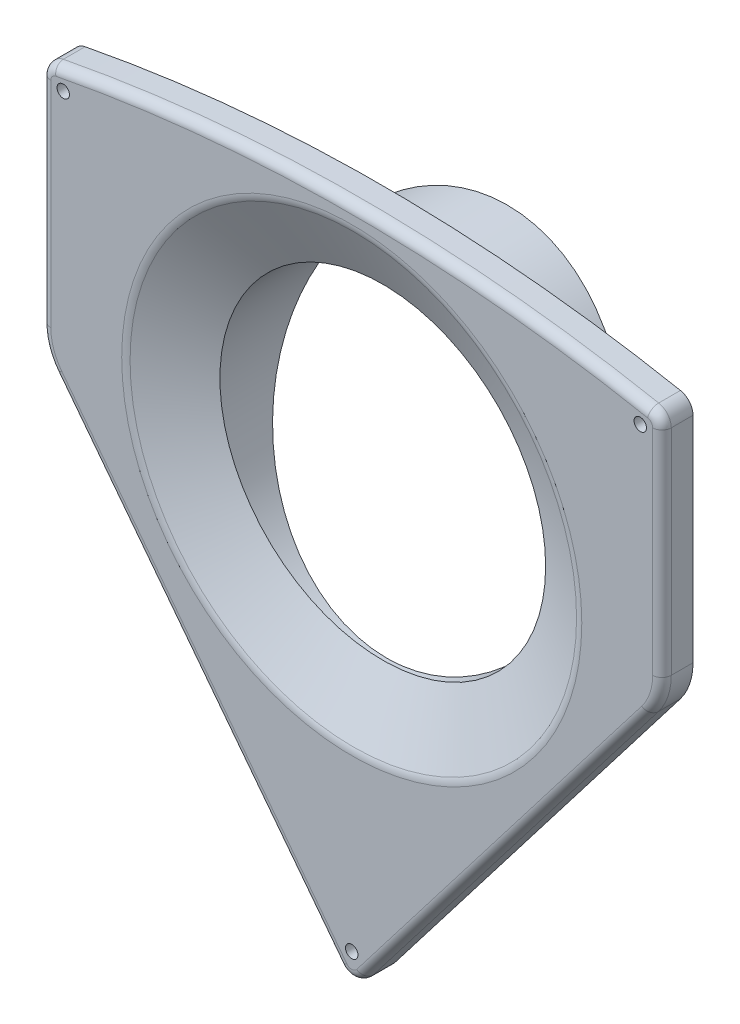
from build123d import *

# Parameters (mm, degrees)
BOSS_EXTRUDE1_DEPTH = 10
SKETCH3_R           = 73
SKETCH2_R           = 52.5
FILLET3_R           = 5
FILLET4_R           = 20
SHELL4_T            = -2
BOSS_EXTRUDE3_START = 8
BOSS_EXTRUDE3_DEPTH = 8
SKETCH16_R          = 2
CUT_EXTRUDE8_DEPTH  = 9
SKETCH5_R           = 54.5
SKETCH5_R_2         = 52.5
BOSS_EXTRUDE2_DEPTH = 60
SKETCH9_R           = 112.367107934
CUT_EXTRUDE5_DEPTH  = 60
SKETCH10_R          = 91.913425111
CUT_EXTRUDE6_DEPTH  = 10
SKETCH11_R          = 79.181330982
CUT_EXTRUDE7_DEPTH  = 10
FILLET5_R           = 5
FILLET6_R           = 5
FILLET7_R           = 3
FILLET8_R           = 5
FILLET9_R           = 2
FILLET10_R          = 5


with BuildPart() as part:
    # Sketch1 → Boss-Extrude1 (new body)
    with BuildSketch(Plane.XY):
        with BuildLine():
            Line((100, 99.277863028), (100, 19.277863028))
            Line((100, 19.277863028), (0, -110.722136972))
            Line((0, -110.722136972), (-100, 19.277863028))
            Line((-100, 19.277863028), (-100, 99.277863028))
            ThreePointArc((-100, 99.277863028), (0, 109.277863028), (100, 99.277863028))
        make_face()
    extrude(amount=BOSS_EXTRUDE1_DEPTH)

    # Sketch3 → Cut-Loft1 section 0
    with BuildSketch(Plane.XY.offset(10)):
        with Locations((0, 29.277863028)):
            Circle(SKETCH3_R)
    # Sketch2 → Cut-Loft1 section 1
    with BuildSketch(Plane.XY):
        with Locations((0, 29.277863028)):
            Circle(SKETCH2_R)
    loft(mode=Mode.SUBTRACT)

    # Fillet3
    fillet3_edges = [part.edges().sort_by_distance(p)[0] for p in [
        (0, -110.722136972, 5),
    ]]
    fillet(fillet3_edges, radius=FILLET3_R)

    # Fillet4
    fillet4_edges = [part.edges().sort_by_distance(p)[0] for p in [
        (100, 19.277863028, 5),
        (-100, 19.277863028, 5),
    ]]
    fillet(fillet4_edges, radius=FILLET4_R)

    # Shell4
    shell4_openings = [part.faces().sort_by_distance(p)[0] for p in [
        (47.569868433, -44.043588356, 0),
    ]]
    offset(amount=SHELL4_T, openings=shell4_openings, kind=Kind.INTERSECTION)

    # Sketch12 → Boss-Extrude3 (add)
    with BuildSketch(Plane(origin=(0, 0, 8), x_dir=(-1, 0, 0), z_dir=(0, 0, -1)).offset(BOSS_EXTRUDE3_START)):
        with BuildLine():
            Line((-9.169512185, -95.521527238), (9.169512185, -95.521527238))
            Line((9.169512185, -95.521527238), (2.377871967, -104.350659521))
            ThreePointArc((2.377871967, -104.350659521), (0, -105.521527238), (-2.377871967, -104.350659521))
            Line((-2.377871967, -104.350659521), (-9.169512185, -95.521527238))
        make_face()
        with BuildLine():
            Line((98, 87.63878568), (98, 97.63878568))
            ThreePointArc((98, 97.63878568), (93.090974034, 98.588565475), (88.172749454, 99.48950087))
            ThreePointArc((88.172749454, 99.48950087), (90.302365562, 91.255493109), (98, 87.63878568))
        make_face()
        with BuildLine():
            Line((-98, 97.63878568), (-98, 87.63878568))
            ThreePointArc((-98, 87.63878568), (-90.302365562, 91.255493109), (-88.172749454, 99.48950087))
            ThreePointArc((-88.172749454, 99.48950087), (-93.090974034, 98.588565475), (-98, 97.63878568))
        make_face()
    extrude(amount=-BOSS_EXTRUDE3_DEPTH)

    # Sketch16 → Cut-Extrude8 (cut, symmetric)
    with BuildSketch(Plane(origin=(0, 0, 8), x_dir=(-1, 0, 0), z_dir=(0, 0, -1))):
        with Locations((0, -99.521527238)):
            Circle(SKETCH16_R)
        with Locations((-93, 94.13878568)):
            Circle(SKETCH16_R)
        with Locations((93, 94.13878568)):
            Circle(SKETCH16_R)
    extrude(amount=CUT_EXTRUDE8_DEPTH, both=True, mode=Mode.SUBTRACT)

    # Sketch5 → Boss-Extrude2 (add)
    with BuildSketch(Plane(origin=(0, 0, 0), x_dir=(-1, 0, 0), z_dir=(0, 0, -1))):
        with Locations(Location((0, 29.277863028, 0), (0, 0, 180))):
            Circle(SKETCH5_R)
        with Locations(Location((0, 29.277863028, 0), (0, 0, 180))):
            Circle(SKETCH5_R_2, mode=Mode.SUBTRACT)
    extrude(amount=BOSS_EXTRUDE2_DEPTH)

    # Sketch9 → Cut-Extrude5 (cut)
    with BuildSketch(Plane(origin=(0, -4.696341029, -10.071335838), x_dir=(-1, 0, 0), z_dir=(0, -0.42261826174070327, -0.9063077870366482))):
        with Locations((0, 89.719397921)):
            Circle(SKETCH9_R)
    extrude(amount=CUT_EXTRUDE5_DEPTH, mode=Mode.SUBTRACT)

    # Sketch10 → Cut-Extrude6 (cut)
    with BuildSketch(Plane(origin=(0, -4.030519152, -9.495308079), x_dir=(-1, 0, 0), z_dir=(0, -0.39073112848928093, -0.9205048534524374))):
        with Locations((0, 68.891691178)):
            Circle(SKETCH10_R)
    extrude(amount=CUT_EXTRUDE6_DEPTH, mode=Mode.SUBTRACT)

    # Sketch11 → Cut-Extrude7 (cut)
    with BuildSketch(Plane(origin=(0, -3.111126453, -8.547749678), x_dir=(-1, 0, 0), z_dir=(0, -0.34202014332567576, -0.9396926207859059))):
        with Locations((0, 55.651285061)):
            Circle(SKETCH11_R)
    extrude(amount=CUT_EXTRUDE7_DEPTH, mode=Mode.SUBTRACT)

    # Fillet5
    fillet5_edges = [part.edges().sort_by_distance(p)[0] for p in [
        (100, 99.277863028, 5),
    ]]
    fillet(fillet5_edges, radius=FILLET5_R)

    # Fillet6
    fillet6_edges = [part.edges().sort_by_distance(p)[0] for p in [
        (-100, 99.277863028, 5),
    ]]
    fillet(fillet6_edges, radius=FILLET6_R)

    # Fillet7
    fillet7_edges = [part.edges().sort_by_distance(p)[0] for p in [
        (0, 109.277863028, 10),
        (98.856812155, 98.351888702, 10),
        (-100, 60.625105075, 10),
        (-98.856812155, 98.351888702, 10),
        (49.907799864, -45.841997149, 10),
        (0, -107.521527238, 10),
        (100, 60.625105075, 10),
        (-49.907799864, -45.841997149, 10),
        (-98.934751063, 19.640177571, 10),
        (98.934751063, 19.640177571, 10),
    ]]
    fillet(fillet7_edges, radius=FILLET7_R)

    # Fillet8
    fillet8_edges = [part.edges().sort_by_distance(p)[0] for p in [
        (-73, 29.277863028, 10),
    ]]
    fillet(fillet8_edges, radius=FILLET8_R)

    # Fillet9
    fillet9_edges = [part.edges().sort_by_distance(p)[0] for p in [
        (-54.5, 29.277863028, 0),
    ]]
    fillet(fillet9_edges, radius=FILLET9_R)

    # Fillet10
    # the kernel refuses this fillet: 5 mm, written as the material it adds along each edge
    with BuildSketch(Plane(origin=(-80, 26.080301962, 8), x_dir=(-1, 0, 0), z_dir=(0, 1, 0))) as fillet10_piece_1:
        with BuildLine():
            CenterArc((18 - FILLET10_R, -FILLET10_R), FILLET10_R, 0, 90)
            Line((18, -FILLET10_R), (18 + FILLET10_R * 0.02, -FILLET10_R))
            Line((18 + FILLET10_R * 0.02, -FILLET10_R), (18 + FILLET10_R * 0.02, FILLET10_R * 0.02))
            Line((18 + FILLET10_R * 0.02, FILLET10_R * 0.02), (18 - FILLET10_R, FILLET10_R * 0.02))
            Line((18 - FILLET10_R, FILLET10_R * 0.02), (18 - FILLET10_R, 0))
        make_face()
    revolve(axis=Axis((-80, 26.080301962, 8), (0, 0, 1)), revolution_arc=37.568592029)
    with BuildSketch(Plane(origin=(-1.548127674, -105.429327102, 8), x_dir=(0.7926239891046, 0.6097107608496924, 0), z_dir=(-0.6097107608496926, 0.7926239891046001, 0))) as fillet10_piece_2_section:
        with BuildLine():
            CenterArc((FILLET10_R, FILLET10_R), FILLET10_R, 180, 90)
            Line((0, FILLET10_R), (-FILLET10_R * 0.02, FILLET10_R))
            Line((-FILLET10_R * 0.02, FILLET10_R), (-FILLET10_R * 0.02, -FILLET10_R * 0.02))
            Line((-FILLET10_R * 0.02, -FILLET10_R * 0.02), (FILLET10_R, -FILLET10_R * 0.02))
            Line((FILLET10_R, -FILLET10_R * 0.02), (FILLET10_R, 0))
        make_face()
    fillet10_piece_2 = extrude(amount=152.07063756, mode=Mode.PRIVATE)
    fillet10_piece_2 = split(fillet10_piece_2, bisect_by=Plane(origin=(-50.54915131, -95.521527238, 6.871784101), z_dir=(0, 1, 0)), keep=Keep.TOP, mode=Mode.PRIVATE)
    add(fillet10_piece_2)
    with BuildSketch(Plane(origin=(-98, 26.080301962, 8), x_dir=(1, 0, 0), z_dir=(0, 1, 0))) as fillet10_piece_3_section:
        with BuildLine():
            CenterArc((FILLET10_R, FILLET10_R), FILLET10_R, 180, 90)
            Line((0, FILLET10_R), (-FILLET10_R * 0.02, FILLET10_R))
            Line((-FILLET10_R * 0.02, FILLET10_R), (-FILLET10_R * 0.02, -FILLET10_R * 0.02))
            Line((-FILLET10_R * 0.02, -FILLET10_R * 0.02), (FILLET10_R, -FILLET10_R * 0.02))
            Line((FILLET10_R, -FILLET10_R * 0.02), (FILLET10_R, 0))
        make_face()
    fillet10_piece_3 = extrude(amount=74.058483718, mode=Mode.PRIVATE)
    fillet10_piece_3 = fillet10_piece_3 - Plane(origin=(-98, 97.63878568, 6.86971186), x_dir=(0.9827250545662549, 0.18507151895348808, 0), z_dir=(0, 0, -1)) * Cylinder(10, 169, mode=Mode.PRIVATE)
    add(fillet10_piece_3)
    with BuildSketch(Plane(origin=(0, -395.722136972, 8), x_dir=(-0.19970369332898327, 0.9798563337912163, 0), z_dir=(-0.9798563337912163, -0.19970369332898327, 0))) as fillet10_piece_4_section:
        with BuildLine():
            CenterArc((503 - FILLET10_R, FILLET10_R), FILLET10_R, 270, 90)
            Line((503, FILLET10_R), (503 + FILLET10_R * 0.02, FILLET10_R))
            Line((503 + FILLET10_R * 0.02, FILLET10_R), (503 + FILLET10_R * 0.02, -FILLET10_R * 0.02))
            Line((503 + FILLET10_R * 0.02, -FILLET10_R * 0.02), (503 - FILLET10_R, -FILLET10_R * 0.02))
            Line((503 - FILLET10_R, -FILLET10_R * 0.02), (503 - FILLET10_R, 0))
        make_face()
    fillet10_piece_4 = revolve(axis=Axis((0, -395.722136972, 8), (0, 0, -1)), revolution_arc=23.03926473, mode=Mode.PRIVATE)
    fillet10_piece_4 = fillet10_piece_4 - Plane(origin=(-98, 97.63878568, 6.609161961), x_dir=(0.9827250545662549, 0.18507151895348808, 0), z_dir=(0, 0, -1)) * Cylinder(10, 2013, mode=Mode.PRIVATE)
    fillet10_piece_4 = fillet10_piece_4 - Plane(origin=(98, 97.63878568, 6.609161961), x_dir=(0, -1, 0), z_dir=(0, 0, -1)) * Cylinder(10, 2013, mode=Mode.PRIVATE)
    add(fillet10_piece_4)


solid = part.part
